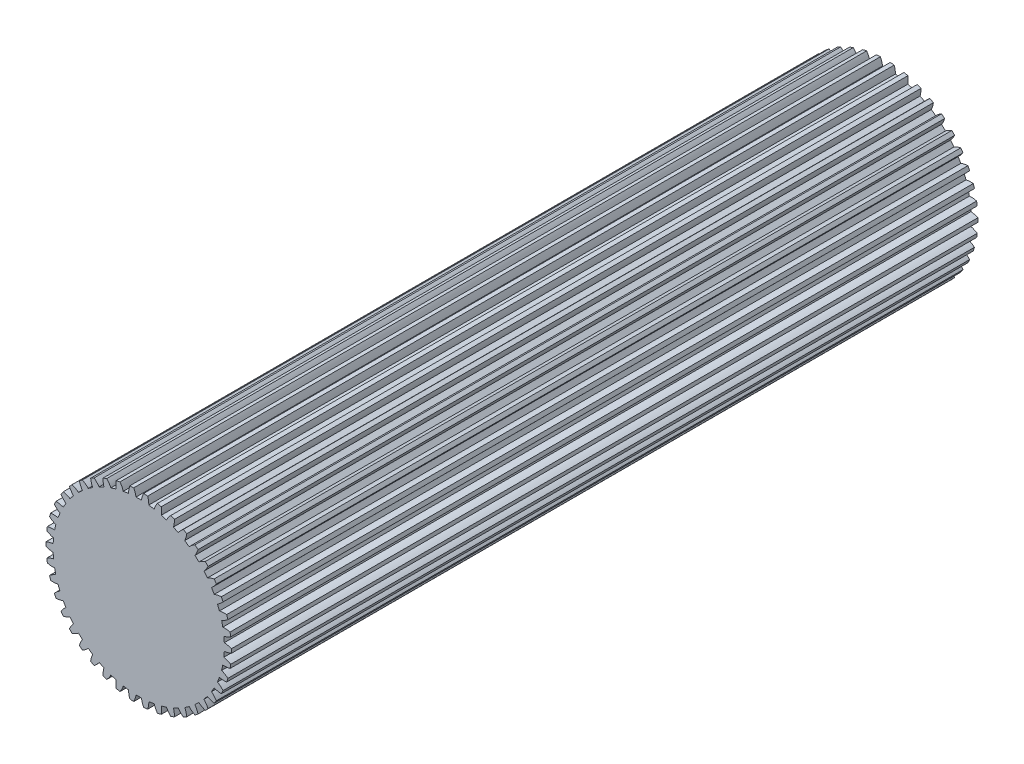
from build123d import *

# Parameters (mm, degrees)
SKETCH1_R           = 18.626666667
BOSS_EXTRUDE1_DEPTH = 150
CUT_EXTRUDE2_DEPTH  = 151
CIRPATTERN1_COUNT   = 42


with BuildPart() as part:
    # Sketch1 → Boss-Extrude1 (new body)
    with BuildSketch(Plane.XY):
        Circle(SKETCH1_R)
    extrude(amount=BOSS_EXTRUDE1_DEPTH)

    # Sketch2 → Cut-Extrude2 (cut, symmetric)
    with BuildSketch(Plane.XY):
        with BuildLine():
            add(Edge.make_bspline(
                [(17.197794317, 0.739009432), (17.203892696, 0.739218074), (17.21543595, 0.73930356), (17.234290481, 0.73910886), (17.271535049, 0.737867759), (17.313692039, 0.735293434), (17.361379443, 0.731228124), (17.412709302, 0.725698856), (17.45664549, 0.720250412), (17.500520881, 0.714143297), (17.54427023, 0.70745302), (17.597315869, 0.698630803), (17.66099398, 0.687053386), (17.735530693, 0.672062459), (17.820194333, 0.653336786), (17.906624473, 0.632403089), (17.991790805, 0.610283496), (18.077983339, 0.586179627), (18.161481204, 0.561614407), (18.248366585, 0.534292881), (18.328644137, 0.508156476), (18.418766174, 0.476867684), (18.491547283, 0.451032541), (18.566887923, 0.422665763), (18.603580461, 0.408611376), (18.622342766, 0.401324063)],
                knots=[0, 0, 0, 0, 0, 0.015083688, 0.02853182, 0.04661014, 0.092110526, 0.119476176, 0.146842496, 0.174208854, 0.201574956, 0.228941013, 0.256307345, 0.307035032, 0.361767352, 0.416499661, 0.471231937, 0.525964282, 0.580696616, 0.635428982, 0.690161387, 0.744893688, 0.799626082, 0.854358407, 0.909090914, 0.909090914, 0.909090914, 0.909090914, 0.909090914], degree=4))
            Line((18.622342766, 0.401324063), (59.986071903, 1.29274036))
            add(Edge.make_bspline(
                [(59.986071903, 1.29274036), (59.984705998, 1.356121459), (59.981788512, 1.47956213), (59.973929675, 1.790524821), (59.96571531, 2.028377944), (59.95367575, 2.372260269), (59.94146295, 2.652288961), (59.926888549, 2.970752343), (59.911256555, 3.265919581), (59.893811207, 3.574911958), (59.874955933, 3.875648951), (59.85453816, 4.180793709), (59.83250074, 4.483826067), (59.809127391, 4.786758311), (59.783837648, 5.091537965), (59.757659801, 5.391726207), (59.728857375, 5.699867489), (59.700322379, 5.99406778), (59.667269491, 6.311146391), (59.637609774, 6.589867618), (59.598261861, 6.931703464), (59.570934309, 7.168124252), (59.532358786, 7.476785046), (59.516845808, 7.599281815), (59.508749995, 7.662158578)],
                knots=[0.083333333, 0.083333333, 0.083333333, 0.083333333, 0.083333333, 0.123015873, 0.162698413, 0.202380952, 0.242063492, 0.281746032, 0.321428571, 0.361111111, 0.400793651, 0.44047619, 0.48015873, 0.51984127, 0.55952381, 0.599206349, 0.638888889, 0.678571429, 0.718253968, 0.757936508, 0.797619048, 0.837301587, 0.876984127, 0.916666667, 0.916666667, 0.916666667, 0.916666667, 0.916666667], degree=4))
            Line((59.508749995, 7.662158578), (18.474160832, 2.378674563))
            add(Edge.make_bspline(
                [(17.115852804, 1.832442931), (17.121914166, 1.833145535), (17.133341232, 1.834781437), (17.151956155, 1.837784085), (17.188599755, 1.844562338), (17.229902204, 1.853391084), (17.276451075, 1.864518426), (17.326383528, 1.877636255), (17.369016937, 1.889572194), (17.411492058, 1.902150385), (17.453755628, 1.915286439), (17.504893908, 1.931916162), (17.566135263, 1.952854998), (17.63760518, 1.978787609), (17.718532281, 2.009922593), (17.800877062, 2.043504222), (17.881795402, 2.07807014), (17.963432742, 2.11475112), (18.042336749, 2.151486678), (18.124179629, 2.191452639), (18.199665119, 2.22926187), (18.284117214, 2.273633185), (18.35223489, 2.310027232), (18.422506189, 2.349306116), (18.456694203, 2.368672266), (18.474160832, 2.378674563)],
                knots=[0, 0, 0, 0, 0, 0.015083688, 0.02853182, 0.04661014, 0.092110526, 0.119476176, 0.146842496, 0.174208854, 0.201574956, 0.228941013, 0.256307345, 0.307035032, 0.361767352, 0.416499661, 0.471231937, 0.525964282, 0.580696616, 0.635428982, 0.690161387, 0.744893688, 0.799626082, 0.854358407, 0.909090914, 0.909090914, 0.909090914, 0.909090914, 0.909090914], degree=4))
            Line((17.115852804, 1.832442931), (17.197794317, 0.739009432))
        make_face()
    cut_extrude2 = extrude(amount=CUT_EXTRUDE2_DEPTH, both=True, mode=Mode.SUBTRACT)

    # CirPattern1: Cut-Extrude2 ×42 about axis
    cirpattern1_axis = Axis((0, 0, -7.5), (0, 0, 1))
    for i in range(1, CIRPATTERN1_COUNT):
        add(cut_extrude2.rotate(cirpattern1_axis, i * 360 / CIRPATTERN1_COUNT), mode=Mode.SUBTRACT)


solid = part.part
